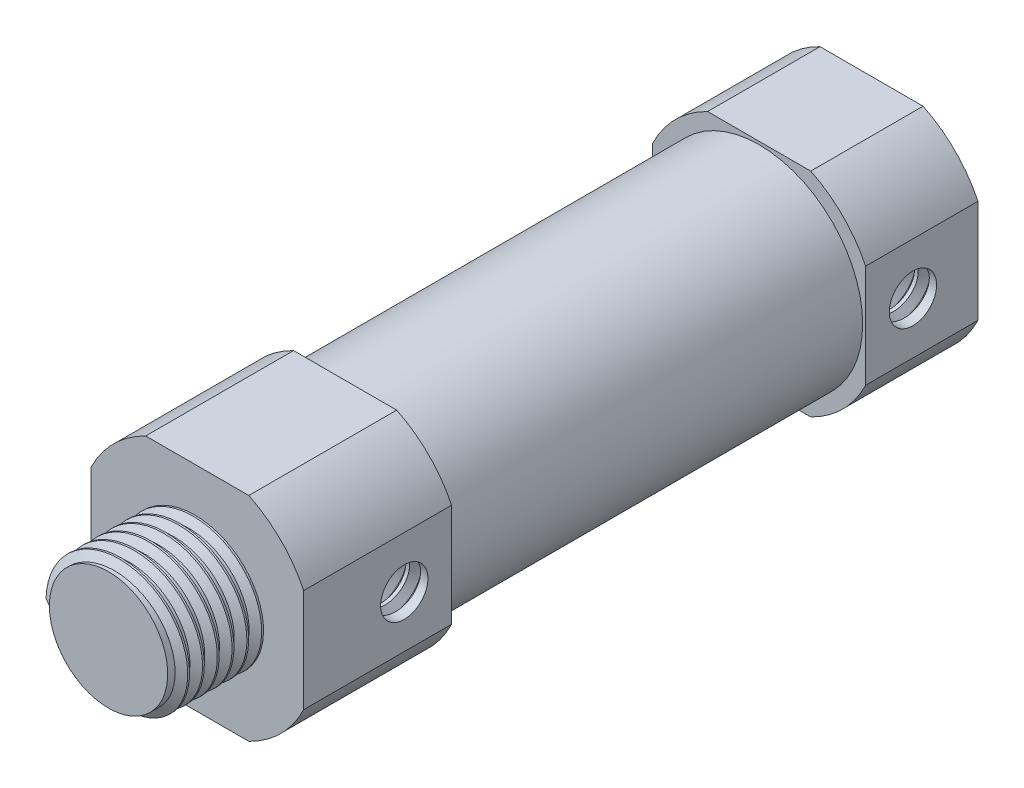
from build123d import *
from build123d.topology import SkipClean

# Parameters (mm, degrees)
SKETCH_1_R          = 10
EXTRUDE_1_DEPTH     = 9.5
SKETCH_2_R          = 15
SKETCH_2_W          = 18
SKETCH_2_H          = 18
CUT_EXTRUDE_1_DEPTH = 9.5
SKETCH_3_R          = 8.75
EXTRUDE_2_DEPTH     = 35
EXTRUDE_3_DEPTH     = 12.5
SKETCH_5_R          = 5
EXTRUDE_4_DEPTH     = 7.5
THREAD_1_PITCH      = 1.25
SKETCH_11_R         = 2
CUT_EXTRUDE_2_DEPTH = 5
THREAD_2_PITCH      = 1.25
THREAD_3_PITCH      = 1.25


with BuildPart() as part:
    # Sketch 1 → 凸台-拉伸1 (new body)
    with BuildSketch(Plane.XY):
        Circle(SKETCH_1_R)
    extrude(amount=EXTRUDE_1_DEPTH)

    # Sketch 2 → 切除-拉伸1 (cut)
    with BuildSketch(Plane.XY.offset(9.5)):
        Circle(SKETCH_2_R)
        Rectangle(SKETCH_2_W, SKETCH_2_H, mode=Mode.SUBTRACT)
    extrude(amount=-CUT_EXTRUDE_1_DEPTH, mode=Mode.SUBTRACT)

    # Sketch 3 → 凸台-拉伸2 (add)
    with BuildSketch(Plane.XY.offset(9.5)):
        Circle(SKETCH_3_R)
    extrude(amount=EXTRUDE_2_DEPTH)

    # 草图4 → 凸台-拉伸3 (add)
    with BuildSketch(Plane.XY.offset(44.5)):
        with BuildLine():
            Line((-4.358898944, -9), (4.358898944, -9))
            ThreePointArc((4.358898944, -9), (7.071067812, -7.071067812), (9, -4.358898944))
            Line((9, -4.358898944), (9, 4.358898944))
            ThreePointArc((9, 4.358898944), (7.071067812, 7.071067812), (4.358898944, 9))
            Line((4.358898944, 9), (-4.358898944, 9))
            ThreePointArc((-4.358898944, 9), (-7.071067812, 7.071067812), (-9, 4.358898944))
            Line((-9, 4.358898944), (-9, -4.358898944))
            ThreePointArc((-9, -4.358898944), (-7.071067812, -7.071067812), (-4.358898944, -9))
        make_face()
    extrude(amount=EXTRUDE_3_DEPTH)

    # 草图5 → 凸台-拉伸4 (add)
    with BuildSketch(Plane.XY.offset(57)):
        Circle(SKETCH_5_R)
    extrude(amount=EXTRUDE_4_DEPTH)

    # 螺纹线1: the profile of Sketch 1 2 profile screwed along a right-hand helix of 6 turns, 8 arcs to a turn; built about Z, then put on its axis
    thread_1_z = Axis((0, 0, 0), (0, 0, 1))
    thread_1_corners = [(4.9997, 0, -0.000173205), (5.676582344, 0, 0.390624998), (5.676582344, 0, 0.546874998), (4.9997, 0, 0.937673202)]
    with BuildLine(mode=Mode.PRIVATE) as thread_1_profile:
        Line(thread_1_corners[0], thread_1_corners[1])
        Line(thread_1_corners[1], thread_1_corners[2])
        Line(thread_1_corners[2], thread_1_corners[3])
        Line(thread_1_corners[3], thread_1_corners[0])
    thread_1_cap = Face(thread_1_profile.wire())
    thread_1_turn_angles = [0, 22.5, 45, 67.5, 90, 112.5, 135, 157.5, 180, 202.5, 225, 247.5, 270, 292.5, 315, 337.5, 360]
    thread_1_turn_weights = [1, 0.9238795325112867, 1, 0.9238795325112867, 1, 0.9238795325112867, 1, 0.9238795325112867, 1, 0.9238795325112867, 1, 0.9238795325112867, 1, 0.9238795325112867, 1, 0.9238795325112867, 1]
    thread_1_turn_rails = [Edge.make_bspline([Vector(p[0], p[1], 0).rotate(thread_1_z, thread_1_turn_angles[k]) / thread_1_turn_weights[k] + Vector(0, 0, p[2] + THREAD_1_PITCH * thread_1_turn_angles[k] / 360) for k in range(17)], [0, 0, 0, 1, 1, 2, 2, 3, 3, 4, 4, 5, 5, 6, 6, 7, 7, 8, 8, 8], 2, thread_1_turn_weights) for p in thread_1_corners]
    thread_1_turn_sides = [Face.make_surface_from_curves(thread_1_turn_rails[p[0]], thread_1_turn_rails[p[1]]) for p in [(0, 1), (1, 2), (2, 3), (3, 0)]]
    thread_1 = Plane(origin=(0, 0, 64.5), x_dir=(-1, 0, 0), z_dir=(0, 0, -1)) * Solid(Shell([*[p.moved(Location((0, 0, THREAD_1_PITCH * i))) for i in range(6) for p in thread_1_turn_sides], thread_1_cap, thread_1_cap.rotate(thread_1_z, 2160).moved(Location((0, 0, THREAD_1_PITCH * 2160 / 360)))]))
    add(thread_1)

    # 草图11 → 切除-拉伸2 (cut)
    with BuildSketch(Plane(origin=(9, 0, 0), x_dir=(0, 0, -1), z_dir=(1, 0, 0))):
        with Locations((-48.5, 0)):
            Circle(SKETCH_11_R)
        with Locations((-5.5, 0)):
            Circle(SKETCH_11_R)
    extrude(amount=-CUT_EXTRUDE_2_DEPTH, mode=Mode.SUBTRACT)

    # 螺纹线2: the profile of Sketch 2 2 profile screwed along a right-hand helix of 4 turns, 8 arcs to a turn; built about Z, then put on its axis
    with SkipClean():  # the faces are left unmerged after this step: merging them gives an invalid solid
        thread_2_z = Axis((0, 0, 0), (0, 0, 1))
        thread_2_corners = [(1.9997, 0, -0.000173205), (2.676582344, 0, 0.390624998), (2.676582344, 0, 0.546874998), (1.9997, 0, 0.937673202)]
        with BuildLine(mode=Mode.PRIVATE) as thread_2_profile:
            Line(thread_2_corners[0], thread_2_corners[1])
            Line(thread_2_corners[1], thread_2_corners[2])
            Line(thread_2_corners[2], thread_2_corners[3])
            Line(thread_2_corners[3], thread_2_corners[0])
        thread_2_cap = Face(thread_2_profile.wire())
        thread_2_turn_angles = [0, 22.5, 45, 67.5, 90, 112.5, 135, 157.5, 180, 202.5, 225, 247.5, 270, 292.5, 315, 337.5, 360]
        thread_2_turn_weights = [1, 0.9238795325112867, 1, 0.9238795325112867, 1, 0.9238795325112867, 1, 0.9238795325112867, 1, 0.9238795325112867, 1, 0.9238795325112867, 1, 0.9238795325112867, 1, 0.9238795325112867, 1]
        thread_2_turn_rails = [Edge.make_bspline([Vector(p[0], p[1], 0).rotate(thread_2_z, thread_2_turn_angles[k]) / thread_2_turn_weights[k] + Vector(0, 0, p[2] + THREAD_2_PITCH * thread_2_turn_angles[k] / 360) for k in range(17)], [0, 0, 0, 1, 1, 2, 2, 3, 3, 4, 4, 5, 5, 6, 6, 7, 7, 8, 8, 8], 2, thread_2_turn_weights) for p in thread_2_corners]
        thread_2_turn_sides = [Face.make_surface_from_curves(thread_2_turn_rails[p[0]], thread_2_turn_rails[p[1]]) for p in [(0, 1), (1, 2), (2, 3), (3, 0)]]
        thread_2 = Plane(origin=(9, 0, 48.5), x_dir=(0, 0, 1), z_dir=(-1, 0, 0)) * Solid(Shell([*[p.moved(Location((0, 0, THREAD_2_PITCH * i))) for i in range(4) for p in thread_2_turn_sides], thread_2_cap, thread_2_cap.rotate(thread_2_z, 1440).moved(Location((0, 0, THREAD_2_PITCH * 1440 / 360)))]))
        add(thread_2, mode=Mode.SUBTRACT)

    # 螺纹线3: the profile of Sketch 3 2 profile screwed along a right-hand helix of 4 turns, 8 arcs to a turn; built about Z, then put on its axis
    with SkipClean():  # the faces are left unmerged after this step: merging them gives an invalid solid
        thread_3_z = Axis((0, 0, 0), (0, 0, 1))
        thread_3_corners = [(1.9997, 0, -0.000173205), (2.676582344, 0, 0.390624998), (2.676582344, 0, 0.546874998), (1.9997, 0, 0.937673202)]
        with BuildLine(mode=Mode.PRIVATE) as thread_3_profile:
            Line(thread_3_corners[0], thread_3_corners[1])
            Line(thread_3_corners[1], thread_3_corners[2])
            Line(thread_3_corners[2], thread_3_corners[3])
            Line(thread_3_corners[3], thread_3_corners[0])
        thread_3_cap = Face(thread_3_profile.wire())
        thread_3_turn_angles = [0, 22.5, 45, 67.5, 90, 112.5, 135, 157.5, 180, 202.5, 225, 247.5, 270, 292.5, 315, 337.5, 360]
        thread_3_turn_weights = [1, 0.9238795325112867, 1, 0.9238795325112867, 1, 0.9238795325112867, 1, 0.9238795325112867, 1, 0.9238795325112867, 1, 0.9238795325112867, 1, 0.9238795325112867, 1, 0.9238795325112867, 1]
        thread_3_turn_rails = [Edge.make_bspline([Vector(p[0], p[1], 0).rotate(thread_3_z, thread_3_turn_angles[k]) / thread_3_turn_weights[k] + Vector(0, 0, p[2] + THREAD_3_PITCH * thread_3_turn_angles[k] / 360) for k in range(17)], [0, 0, 0, 1, 1, 2, 2, 3, 3, 4, 4, 5, 5, 6, 6, 7, 7, 8, 8, 8], 2, thread_3_turn_weights) for p in thread_3_corners]
        thread_3_turn_sides = [Face.make_surface_from_curves(thread_3_turn_rails[p[0]], thread_3_turn_rails[p[1]]) for p in [(0, 1), (1, 2), (2, 3), (3, 0)]]
        thread_3 = Plane(origin=(9, 0, 5.5), x_dir=(0, 0, 1), z_dir=(-1, 0, 0)) * Solid(Shell([*[p.moved(Location((0, 0, THREAD_3_PITCH * i))) for i in range(4) for p in thread_3_turn_sides], thread_3_cap, thread_3_cap.rotate(thread_3_z, 1440).moved(Location((0, 0, THREAD_3_PITCH * 1440 / 360)))]))
        add(thread_3, mode=Mode.SUBTRACT)


solid = part.part
